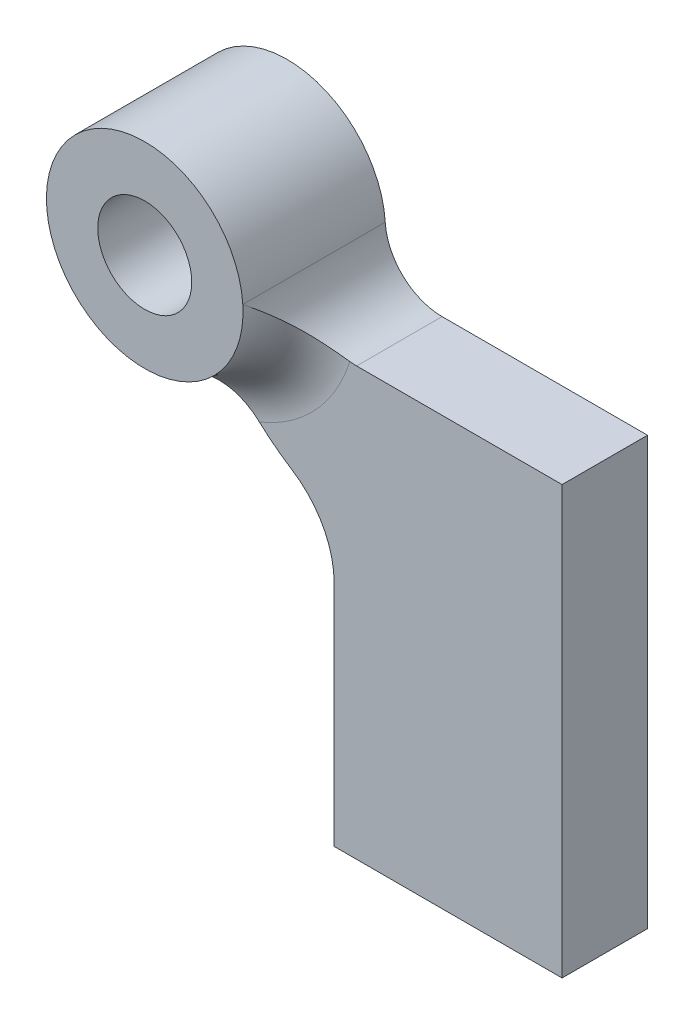
from build123d import *

# Parameters (mm, degrees)
SKETCH1_R           = 3.45
SKETCH1_R_2         = 1.65
BOSS_EXTRUDE1_DEPTH = 5
SKETCH2_W           = 11
SKETCH2_H           = 15
BOSS_EXTRUDE2_DEPTH = 3
FILLET1_R           = 2
CUT_EXTRUDE1_DEPTH  = 22.499883744
FILLET2_R           = 8


with BuildPart() as part:
    # Sketch1 → Boss-Extrude1 (new body)
    with BuildSketch(Plane.XY):
        Circle(SKETCH1_R)
        Circle(SKETCH1_R_2, mode=Mode.SUBTRACT)
    extrude(amount=BOSS_EXTRUDE1_DEPTH)

    # Sketch2 → Boss-Extrude2 (add)
    with BuildSketch(Plane(origin=(0, 0, 0), x_dir=(-1, 0, 0), z_dir=(0, 0, -1))):
        with Locations((-7.15, -9.15)):
            Rectangle(SKETCH2_W, SKETCH2_H)
    extrude(amount=-BOSS_EXTRUDE2_DEPTH)

    # Fillet1
    # the kernel refuses this fillet: 2 mm, written as the material it adds along each edge
    with BuildSketch(Plane(origin=(0, 0, 3), x_dir=(0.5811301681486029, 0.8138106215008357, 0), z_dir=(-0.8138106215008357, 0.5811301681486029, 0))) as fillet1_piece_1_section:
        with BuildLine():
            CenterArc((3.45 + FILLET1_R, -FILLET1_R), FILLET1_R, 90, 90)
            Line((3.45 + FILLET1_R, 0), (3.45 + FILLET1_R, FILLET1_R * 0.02))
            Line((3.45 + FILLET1_R, FILLET1_R * 0.02), (3.45 - FILLET1_R * 0.02, FILLET1_R * 0.02))
            Line((3.45 - FILLET1_R * 0.02, FILLET1_R * 0.02), (3.45 - FILLET1_R * 0.02, -FILLET1_R))
            Line((3.45 - FILLET1_R * 0.02, -FILLET1_R), (3.45, -FILLET1_R))
        make_face()
    fillet1_piece_1 = revolve(axis=Axis((0, 0, 3), (0, 0, -1)), revolution_arc=198.93985607, mode=Mode.PRIVATE)
    fillet1_piece_1 = split(fillet1_piece_1, bisect_by=Plane(origin=(1.65, -2.775668714, 3.387031985), z_dir=(1, 0, 0)), keep=Keep.TOP, mode=Mode.PRIVATE)
    fillet1_piece_1 = split(fillet1_piece_1, bisect_by=Plane(origin=(2.775669412, -1.65, 3.387031985), z_dir=(0, -1, 0)), keep=Keep.TOP, mode=Mode.PRIVATE)
    add(fillet1_piece_1)
    with BuildSketch(Plane(origin=(1.65, -3.029851482, 3), x_dir=(-0.9765037028672113, -0.21550062247386903, 0), z_dir=(0, 0, -1))) as fillet1_piece_2:
        with BuildLine():
            CenterArc((2.472126505, -1.921296938), FILLET1_R, 106.126978769, 86.317920605)
            Line((0.519119099, -2.352298183), (0.480058951, -2.360918208))
            Line((0.480058951, -2.360918208), (-0.039060148, -0.008620025))
            Line((-0.039060148, -0.008620025), (0.011110681, 0.038425939))
            ThreePointArc((0.011110681, 0.038425939), (0.958296229, -0.095762782), (1.905481778, 0.038425939))
            Line((1.905481778, 0.038425939), (1.916592459, 0))
        make_face()
    extrude(amount=3)
    with BuildSketch(Plane(origin=(3.029851482, -1.65, 3), x_dir=(0.21550062247386917, 0.9765037028672113, 0), z_dir=(0, 0, -1))) as fillet1_piece_3:
        with BuildLine():
            CenterArc((2.472126505, 1.921296938), FILLET1_R, 167.555100626, 86.317920605)
            Line((0.519119099, 2.352298183), (0.480058951, 2.360918208))
            Line((0.480058951, 2.360918208), (-0.039060148, 0.008620025))
            Line((-0.039060148, 0.008620025), (0.011110681, -0.038425939))
            ThreePointArc((0.011110681, -0.038425939), (0.958296229, 0.095762782), (1.905481778, -0.038425939))
            Line((1.905481778, -0.038425939), (1.916592459, 0))
        make_face()
    extrude(amount=3)
    with BuildSketch(Plane(origin=(0, 0, 3), x_dir=(0.5811301681486029, 0.8138106215008357, 0), z_dir=(-0.8138106215008357, 0.5811301681486029, 0))) as fillet1_piece_4a_section:
        with BuildLine():
            CenterArc((3.45 + FILLET1_R, -FILLET1_R), FILLET1_R, 90, 90)
            Line((3.45 + FILLET1_R, 0), (3.45 + FILLET1_R, FILLET1_R * 0.02))
            Line((3.45 + FILLET1_R, FILLET1_R * 0.02), (3.45 - FILLET1_R * 0.02, FILLET1_R * 0.02))
            Line((3.45 - FILLET1_R * 0.02, FILLET1_R * 0.02), (3.45 - FILLET1_R * 0.02, -FILLET1_R))
            Line((3.45 - FILLET1_R * 0.02, -FILLET1_R), (3.45, -FILLET1_R))
        make_face()
    fillet1_piece_4a = revolve(axis=Axis((0, 0, 3), (0, 0, -1)), revolution_arc=198.93985607, mode=Mode.PRIVATE)
    fillet1_piece_4a = split(fillet1_piece_4a, bisect_by=Plane(origin=(3.505644008, -1.65, 3.43409217), z_dir=(0, 1, 0)), keep=Keep.TOP, mode=Mode.PRIVATE)
    with BuildSketch(Plane(origin=(3.029851482, -1.65, 9.022245937), x_dir=(0.21550062247386909, 0.9765037028672113, 0), z_dir=(0, 0, -1))) as fillet1_piece_4b_section:
        with BuildLine():
            CenterArc((2.472126505, 1.921296938), FILLET1_R, 167.555100626, 86.317920605)
            Line((0.519119099, 2.352298183), (0.480058951, 2.360918208))
            Line((0.480058951, 2.360918208), (-0.039060148, 0.008620025))
            Line((-0.039060148, 0.008620025), (0.011110681, -0.038425939))
            ThreePointArc((0.011110681, -0.038425939), (0.958296229, 0.095762782), (1.905481778, -0.038425939))
            Line((1.905481778, -0.038425939), (1.916592459, 0))
        make_face()
    fillet1_piece_4b = extrude(amount=9.022245937, mode=Mode.PRIVATE)
    fillet1_piece_4b = split(fillet1_piece_4b, bisect_by=Plane(origin=(3.781400642, -1.225418489, 3), z_dir=(0, 0, 1)), keep=Keep.TOP, mode=Mode.PRIVATE)
    fillet1_piece_4 = fillet1_piece_4a & fillet1_piece_4b
    add(fillet1_piece_4)
    with BuildSketch(Plane(origin=(1.65, -3.029851482, 9.022245937), x_dir=(-0.9765037028672113, -0.2155006224738689, 0), z_dir=(0, 0, -1))) as fillet1_piece_5a_section:
        with BuildLine():
            CenterArc((2.472126505, -1.921296938), FILLET1_R, 106.126978769, 86.317920605)
            Line((0.519119099, -2.352298183), (0.480058951, -2.360918208))
            Line((0.480058951, -2.360918208), (-0.039060148, -0.008620025))
            Line((-0.039060148, -0.008620025), (0.011110681, 0.038425939))
            ThreePointArc((0.011110681, 0.038425939), (0.958296229, -0.095762782), (1.905481778, 0.038425939))
            Line((1.905481778, 0.038425939), (1.916592459, 0))
        make_face()
    fillet1_piece_5a = extrude(amount=9.022245937, mode=Mode.PRIVATE)
    fillet1_piece_5a = split(fillet1_piece_5a, bisect_by=Plane(origin=(1.225418489, -3.781400642, 3), z_dir=(0, 0, 1)), keep=Keep.TOP, mode=Mode.PRIVATE)
    with BuildSketch(Plane(origin=(0, 0, 3), x_dir=(0.5811301681486029, 0.8138106215008357, 0), z_dir=(-0.8138106215008357, 0.5811301681486029, 0))) as fillet1_piece_5b_section:
        with BuildLine():
            CenterArc((3.45 + FILLET1_R, -FILLET1_R), FILLET1_R, 90, 90)
            Line((3.45 + FILLET1_R, 0), (3.45 + FILLET1_R, FILLET1_R * 0.02))
            Line((3.45 + FILLET1_R, FILLET1_R * 0.02), (3.45 - FILLET1_R * 0.02, FILLET1_R * 0.02))
            Line((3.45 - FILLET1_R * 0.02, FILLET1_R * 0.02), (3.45 - FILLET1_R * 0.02, -FILLET1_R))
            Line((3.45 - FILLET1_R * 0.02, -FILLET1_R), (3.45, -FILLET1_R))
        make_face()
    fillet1_piece_5b = revolve(axis=Axis((0, 0, 3), (0, 0, -1)), revolution_arc=198.93985607, mode=Mode.PRIVATE)
    fillet1_piece_5b = split(fillet1_piece_5b, bisect_by=Plane(origin=(1.65, -3.505643385, 3.43409212), z_dir=(-1, 0, 0)), keep=Keep.TOP, mode=Mode.PRIVATE)
    fillet1_piece_5 = fillet1_piece_5a & fillet1_piece_5b
    add(fillet1_piece_5)

    # Sketch3 → Cut-Extrude1 (cut, through all)
    with BuildSketch(Plane(origin=(0, 0, 0), x_dir=(-1, 0, 0), z_dir=(0, 0, -1))):
        with BuildLine():
            Line((-4.65, -16.65), (-4.65, -8.65))
            ThreePointArc((-4.65, -8.65), (-3.783315491, -6.452721713), (-1.65, -5.438749856))
            Line((-1.65, -5.438749856), (-1.65, -16.65))
            Line((-1.65, -16.65), (-4.65, -16.65))
        make_face()
    extrude(amount=-CUT_EXTRUDE1_DEPTH, mode=Mode.SUBTRACT)

    # Fillet2
    fillet2_edges = [part.edges().sort_by_distance(p)[0] for p in [
        (1.65, -5.438749856, 1.5),
    ]]
    fillet(fillet2_edges, radius=FILLET2_R)


solid = part.part
